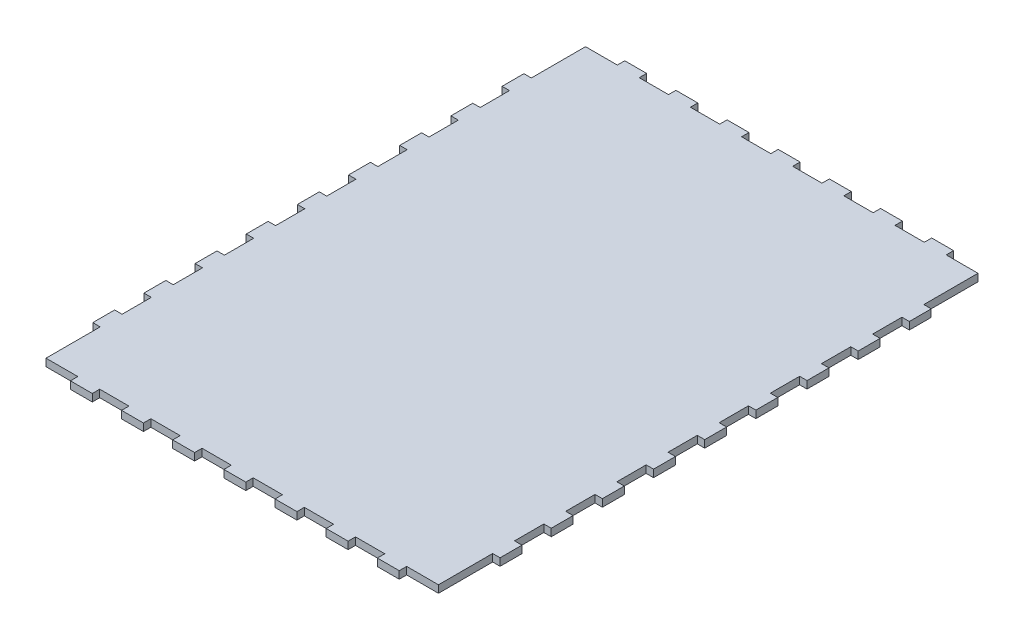
from build123d import *

# Parameters (mm, degrees)
BOSS_EXTRUDE1_DEPTH = 5.08


with BuildPart() as part:
    # Sketch1 → Boss-Extrude1 (new body)
    with BuildSketch(Plane(origin=(0, 0, 0), x_dir=(1, 0, 0), z_dir=(0, 1, 0))):
        Polygon((8.352742883, -181.151563721), (28.404742883, -181.151563721), (28.404742883, -186.227466705), (43.404742883, -186.227466705), (43.404742883, -181.151563721), (63.456742883, -181.151563721), (63.456742883, -186.227466705), (78.456742883, -186.227466705), (78.456742883, -181.151563721), (98.508742883, -181.151563721), (98.508742883, -186.227466705), (113.508742883, -186.227466705), (113.508742883, -181.151563721), (133.560742883, -181.151563721), (133.560742883, -186.227466705), (148.560742883, -186.227466705), (148.560742883, -181.151563721), (168.612742883, -181.151563721), (168.612742883, -186.227466705), (183.612742883, -186.227466705), (183.612742883, -181.151563721), (205.413519222, -181.151563721), (205.413519222, -144.020546476), (210.493519222, -144.020546476), (210.493519222, -129.020546476), (205.413519222, -129.020546476), (205.413519222, -108.968546476), (210.493519222, -108.968546476), (210.493519222, -93.968546476), (205.413519222, -93.968546476), (205.413519222, -73.916546476), (210.493519222, -73.916546476), (210.493519222, -58.916546476), (205.413519222, -58.916546476), (205.413519222, -38.864546476), (210.493519222, -38.864546476), (210.493519222, -23.864546476), (205.413519222, -23.864546476), (205.413519222, -3.812546476), (210.493519222, -3.812546476), (210.493519222, 11.187453524), (205.413519222, 11.187453524), (205.413519222, 31.239453524), (210.493519222, 31.239453524), (210.493519222, 46.239453524), (205.413519222, 46.239453524), (205.413519222, 66.291453524), (210.493519222, 66.291453524), (210.493519222, 81.291453524), (205.413519222, 81.291453524), (205.413519222, 101.343453524), (210.493519222, 101.343453524), (210.493519222, 116.343453524), (205.413519222, 116.343453524), (205.413519222, 136.395453524), (210.493519222, 136.395453524), (210.493519222, 151.395453524), (205.413519222, 151.395453524), (205.413519222, 188.522396615), (183.612742883, 188.522396615), (183.612742883, 193.5982996), (168.612742883, 193.5982996), (168.612742883, 188.522396615), (148.560742883, 188.522396615), (148.560742883, 193.5982996), (133.560742883, 193.5982996), (133.560742883, 188.522396615), (113.508742883, 188.522396615), (113.508742883, 193.5982996), (98.508742883, 193.5982996), (98.508742883, 188.522396615), (78.456742883, 188.522396615), (78.456742883, 193.5982996), (63.456742883, 193.5982996), (63.456742883, 188.522396615), (43.404742883, 188.522396615), (43.404742883, 193.5982996), (28.404742883, 193.5982996), (28.404742883, 188.522396615), (8.352742883, 188.522396615), (8.352742883, 193.5982996), (-6.647257117, 193.5982996), (-6.647257117, 188.522396615), (-26.699257117, 188.522396615), (-26.699257117, 193.5982996), (-41.699257117, 193.5982996), (-41.699257117, 188.522396615), (-63.500033457, 188.522396615), (-63.500033457, 151.395453524), (-68.580033457, 151.395453524), (-68.580033457, 136.395453524), (-63.500033457, 136.395453524), (-63.500033457, 116.343453524), (-68.580033457, 116.343453524), (-68.580033457, 101.343453524), (-63.500033457, 101.343453524), (-63.500033457, 81.291453524), (-68.580033457, 81.291453524), (-68.580033457, 66.291453524), (-63.500033457, 66.291453524), (-63.500033457, 46.239453524), (-68.580033457, 46.239453524), (-68.580033457, 31.239453524), (-63.500033457, 31.239453524), (-63.500033457, 11.187453524), (-68.580033457, 11.187453524), (-68.580033457, -3.812546476), (-63.500033457, -3.812546476), (-63.500033457, -23.864546476), (-68.580033457, -23.864546476), (-68.580033457, -38.864546476), (-63.500033457, -38.864546476), (-63.500033457, -58.916546476), (-68.580033457, -58.916546476), (-68.580033457, -73.916546476), (-63.500033457, -73.916546476), (-63.500033457, -93.968546476), (-68.580033457, -93.968546476), (-68.580033457, -108.968546476), (-63.500033457, -108.968546476), (-63.500033457, -129.020546476), (-68.580033457, -129.020546476), (-68.580033457, -144.020546476), (-63.500033457, -144.020546476), (-63.500033457, -181.151563721), (-41.699257117, -181.151563721), (-41.699257117, -186.227466705), (-26.699257117, -186.227466705), (-26.699257117, -181.151563721), (-6.647257117, -181.151563721), (-6.647257117, -186.227466705), (8.352742883, -186.227466705), align=None)
    extrude(amount=BOSS_EXTRUDE1_DEPTH)


solid = part.part
